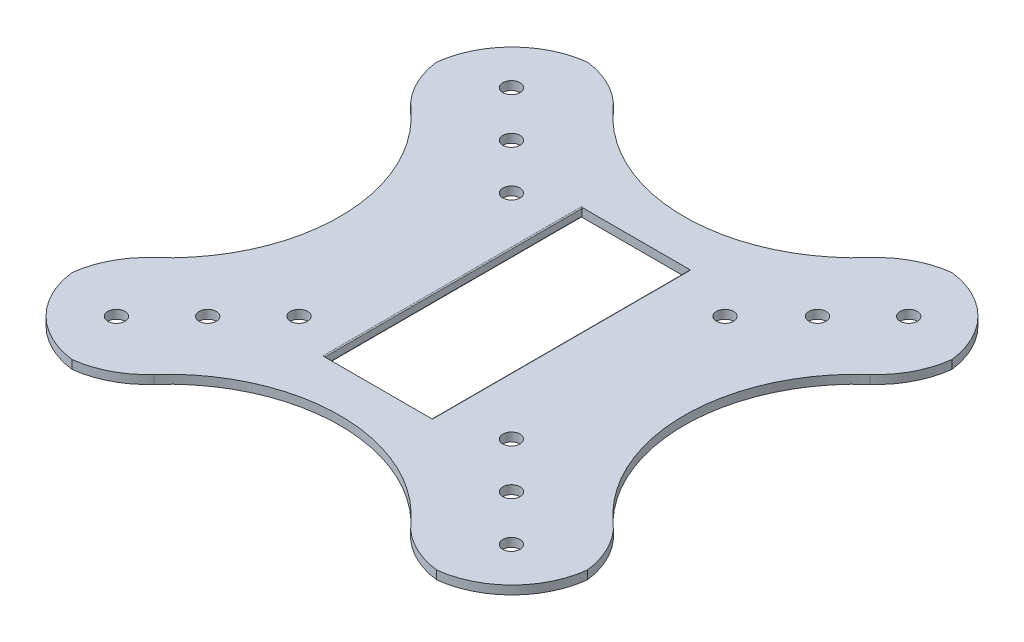
from build123d import *

# Parameters (mm, degrees)
SKETCH1_W           = 120
SKETCH1_H           = 120
BOSS_EXTRUDE1_DEPTH = 2
SKETCH2_R           = 40
CUT_EXTRUDE1_DEPTH  = 85.876380696
FILLET1_R           = 20
SKETCH3_R           = 2
CUT_EXTRUDE2_DEPTH  = 85.678716097
CUT_EXTRUDE5_DEPTH  = 2
SKETCH4_W           = 25
SKETCH4_H           = 60
CUT_EXTRUDE6_DEPTH  = 10
FILLET2_R           = 0.25


with BuildPart() as part:
    # Sketch1 → Boss-Extrude1 (new body)
    with BuildSketch(Plane(origin=(0, 0, 0), x_dir=(1, 0, 0), z_dir=(0, 1, 0))):
        Rectangle(SKETCH1_W, SKETCH1_H)
    extrude(amount=BOSS_EXTRUDE1_DEPTH)

    # Sketch2 → Cut-Extrude1 (cut, through all)
    with BuildSketch(Plane(origin=(0, 2, 0), x_dir=(1, 0, 0), z_dir=(0, 1, 0))):
        with Locations((-80, 0)):
            Circle(SKETCH2_R)
        with Locations((80, 0)):
            Circle(SKETCH2_R)
        with Locations((0, 80)):
            Circle(SKETCH2_R)
        with Locations((0, -80)):
            Circle(SKETCH2_R)
    extrude(amount=-CUT_EXTRUDE1_DEPTH, mode=Mode.SUBTRACT)

    # Fillet1
    # the kernel refuses this fillet: 20 mm, written as the material it takes off along each edge
    with BuildSketch(Plane(origin=(60, -25.200858497, -34.641016151), x_dir=(-0.8099888551809121, 0, 0.5864452698101633), z_dir=(0, 1, 0)), Plane(origin=(-60, -25.200858497, 34.641016151), x_dir=(0.8099888551809128, 0, -0.5864452698101625), z_dir=(0, 1, 0)), Plane(origin=(34.641016151, -25.200858497, 60), x_dir=(-0.5864452698101633, 0, -0.8099888551809121), z_dir=(0, 1, 0))) as fillet1_piece_1:
        with BuildLine():
            CenterArc((10.288207399, -19.893871205), FILLET1_R, 95.905157448, 48.189685104)
            Line((-5.911569704, -8.164965809), (0, 0))
            ThreePointArc((0, 0), (4.11528296, -0.212257589), (8.23056592, 0))
        make_face()
    extrude(amount=52.401716993, mode=Mode.SUBTRACT)
    with BuildSketch(Plane(origin=(60, -25.200858497, 34.641016151), x_dir=(0, 0, 1), z_dir=(0, 1, 0)), Plane(origin=(34.641016151, -25.200858497, -60), x_dir=(1, 0, 0), z_dir=(0, 1, 0)), Plane(origin=(-60, -25.200858497, -34.641016151), x_dir=(0, 0, -1), z_dir=(0, 1, 0)), Plane(origin=(-34.641016151, -25.200858497, 60), x_dir=(-1, 0, 0), z_dir=(0, 1, 0))) as fillet1_piece_2:
        with BuildLine():
            CenterArc((10.080343399, -20), FILLET1_R, 90, 48.189685104)
            ThreePointArc((-4.826776451, -6.666666667), (-2.241461944, -3.457810792), (0, 0))
            Line((0, 0), (10.080343399, 0))
        make_face()
    extrude(amount=52.401716993, mode=Mode.SUBTRACT)
    with BuildSketch(Plane(origin=(60, -50, -60), x_dir=(0, 0, 1), z_dir=(0, 1, 0)), Plane(origin=(-60, -50, -60), x_dir=(1, 0, 0), z_dir=(0, 1, 0)), Plane(origin=(-60, -50, 60), x_dir=(0, 0, -1), z_dir=(0, 1, 0)), Plane(origin=(60, -50, 60), x_dir=(-1, 0, 0), z_dir=(0, 1, 0))) as fillet1_piece_3:
        with BuildLine():
            CenterArc((FILLET1_R, -FILLET1_R), FILLET1_R, 90, 90)
            Line((0, -FILLET1_R), (0, 0))
            Line((0, 0), (FILLET1_R, 0))
        make_face()
    extrude(amount=102, mode=Mode.SUBTRACT)
    with BuildSketch(Plane(origin=(-34.641016151, -25.200858497, -60), x_dir=(-1, 0, 0), z_dir=(0, 1, 0))) as fillet1_piece_4:
        with BuildLine():
            CenterArc((10.080343399, 20), FILLET1_R, 221.810314896, 48.189685104)
            ThreePointArc((-4.826776451, 6.666666667), (-2.241461944, 3.457810792), (0, 0))
            Line((0, 0), (10.080343399, 0))
        make_face()
    extrude(amount=52.401716993, mode=Mode.SUBTRACT)

    # Sketch3 → Cut-Extrude2 (cut, through all)
    with BuildSketch(Plane(origin=(0, 2, 0), x_dir=(1, 0, 0), z_dir=(0, 1, 0))):
        with Locations(Location((24.811594087, 24.685720546, 0), (0, 0, 270))):
            Circle(SKETCH3_R)
        with Locations(Location((35.552313385, 35.426521893, 0), (0, 0, 270))):
            Circle(SKETCH3_R)
        with Locations(Location((46.158887911, 46.033177444, 0), (0, 0, 270))):
            Circle(SKETCH3_R)
        with Locations(Location((-24.814082933, 24.683218757, 0), (0, 0, 270))):
            Circle(SKETCH3_R)
        with Locations(Location((-24.685531008, -24.811782662, 0), (0, 0, 270))):
            Circle(SKETCH3_R)
        with Locations(Location((24.682861408, -24.814438392, 0), (0, 0, 270))):
            Circle(SKETCH3_R)
        with Locations(Location((-35.420634793, 35.289923362, 0), (0, 0, 270))):
            Circle(SKETCH3_R)
        with Locations(Location((-46.027174415, 45.896615729, 0), (0, 0, 270))):
            Circle(SKETCH3_R)
        with Locations(Location((-35.292116686, -35.418449365, 0), (0, 0, 270))):
            Circle(SKETCH3_R)
        with Locations(Location((-45.89869107, -46.025104773, 0), (0, 0, 270))):
            Circle(SKETCH3_R)
        with Locations(Location((35.289386753, -35.421116482, 0), (0, 0, 270))):
            Circle(SKETCH3_R)
        with Locations(Location((45.895912098, -46.027794572, 0), (0, 0, 270))):
            Circle(SKETCH3_R)
    extrude(amount=-CUT_EXTRUDE2_DEPTH, mode=Mode.SUBTRACT)

    # Sketch7 → Cut-Extrude5 (cut)
    with BuildSketch(Plane(origin=(0, 2, 0), x_dir=(1, 0, 0), z_dir=(0, 1, 0))):
        with BuildLine():
            Line((5, 15.800253916), (5, -14.199746084))
            ThreePointArc((5, -14.199746084), (0, -19.199746084), (-5, -14.199746084))
            Line((-5, -14.199746084), (-5, 15.800253916))
            ThreePointArc((-5, 15.800253916), (0, 20.800253916), (5, 15.800253916))
        make_face()
    extrude(amount=-CUT_EXTRUDE5_DEPTH, mode=Mode.SUBTRACT)

    # Sketch4 → Cut-Extrude6 (cut)
    with BuildSketch(Plane(origin=(0, 2, 0), x_dir=(1, 0, 0), z_dir=(0, 1, 0))):
        with Locations((-1.216184952, 0)):
            Rectangle(SKETCH4_W, SKETCH4_H)
    extrude(amount=-CUT_EXTRUDE6_DEPTH, mode=Mode.SUBTRACT)

    # Fillet2
    fillet2_edges = [part.edges().sort_by_distance(p)[0] for p in [
        (-13.716184952, 0, 0),
        (11.283815048, 0, 0),
        (11.283815048, 2, 0),
        (-13.716184952, 2, 0),
    ]]
    fillet(fillet2_edges, radius=FILLET2_R)


solid = part.part
